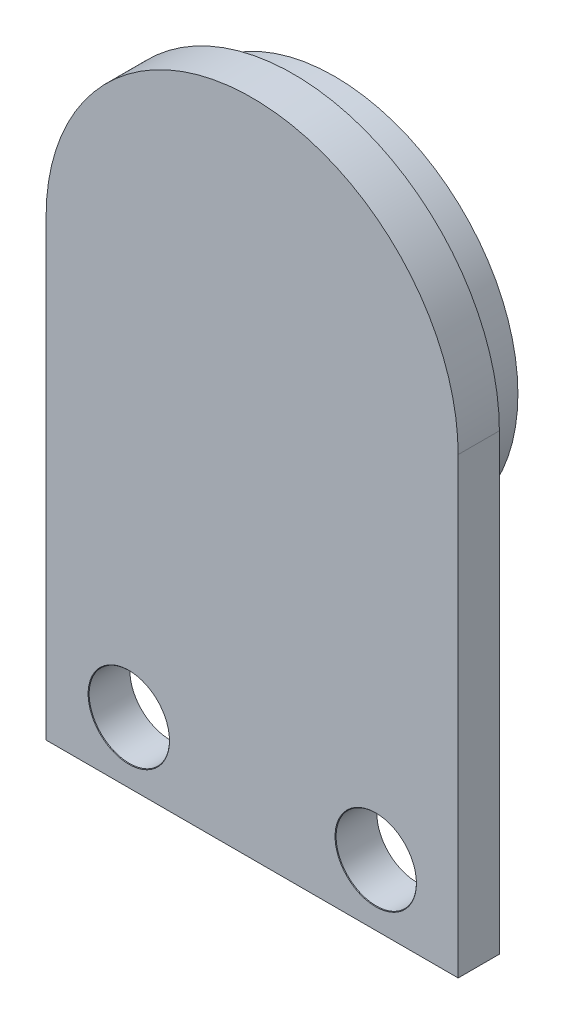
from build123d import *

# Parameters (mm, degrees)
BOSS_EXTRUDE1_DEPTH              = 2
SKETCH2_R                        = 8.9
BOSS_EXTRUDE2_DEPTH              = 2
SKETCH3_R                        = 2
BOSS_EXTRUDE3_DEPTH              = 3
M3_5_CLEARANCE_HOLE1_D           = 3.9
M3_5_CLEARANCE_HOLE1_CSINK_D     = 3.95
M3_5_CLEARANCE_HOLE1_CSINK_ANGLE = 90


with BuildPart() as part:
    # Sketch1 → Boss-Extrude1 (new body)
    with BuildSketch(Plane.XY):
        with BuildLine():
            Line((-10, 0), (-10, -22))
            Line((-10, -22), (10, -22))
            Line((10, -22), (10, 0))
            ThreePointArc((10, 0), (0, 10), (-10, 0))
        make_face()
    extrude(amount=BOSS_EXTRUDE1_DEPTH)

    # Sketch2 → Boss-Extrude2 (add)
    with BuildSketch(Plane(origin=(0, 0, 0), x_dir=(-1, 0, 0), z_dir=(0, 0, -1))):
        Circle(SKETCH2_R)
    extrude(amount=BOSS_EXTRUDE2_DEPTH)

    # Sketch3 → Boss-Extrude3 (add)
    with BuildSketch(Plane(origin=(0, 0, -2), x_dir=(-1, 0, 0), z_dir=(0, 0, -1))):
        Circle(SKETCH3_R)
    extrude(amount=BOSS_EXTRUDE3_DEPTH)

    # M3.5 Clearance Hole1 (through all)
    with Locations(Plane.XY.offset(2)):
        with Locations((6, -19.034139186), (-5.984773914, -19.034139186)):
            CounterSinkHole(M3_5_CLEARANCE_HOLE1_D / 2, M3_5_CLEARANCE_HOLE1_CSINK_D / 2, counter_sink_angle=M3_5_CLEARANCE_HOLE1_CSINK_ANGLE)


solid = part.part
